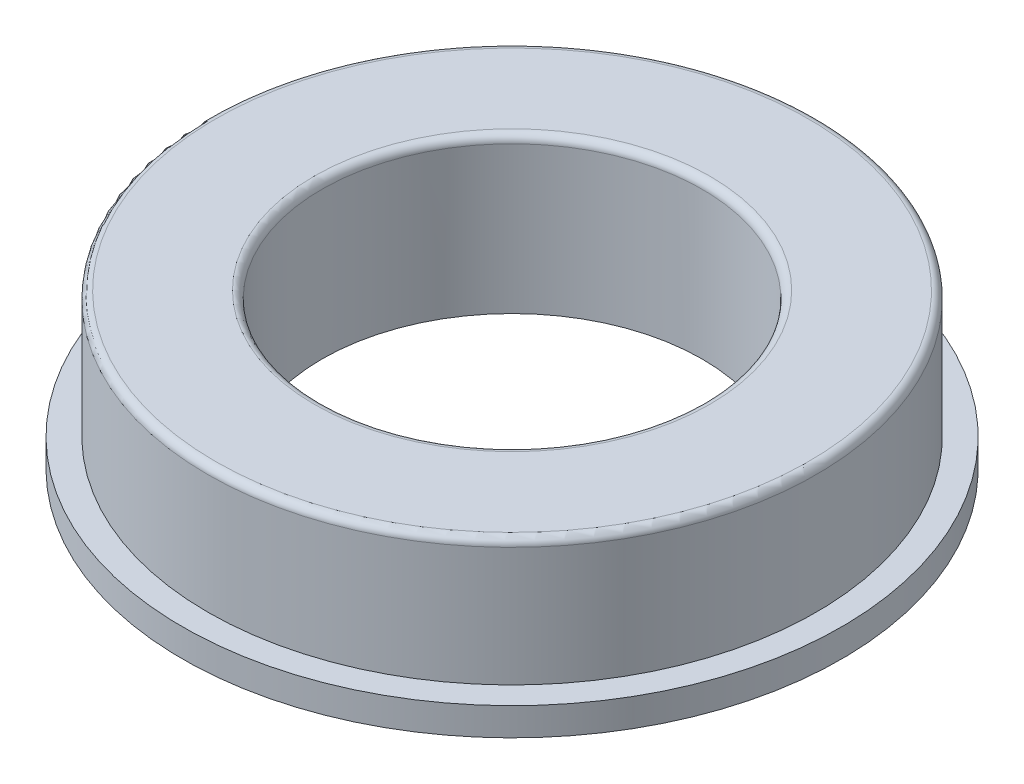
from build123d import *

# Parameters (mm, degrees)
SKETCH_2_R          = 13
EXTRUDE_1_DEPTH     = 1.1
CUT_EXTRUDE_1_REACH = 21.053
SKETCH_3_R          = 7.5


with BuildPart() as part:
    # 草图1 → 旋转1 (revolve)
    with BuildSketch(Plane(origin=(0, 0, 0), x_dir=(-1, 0, 0), z_dir=(0, 0, -1))):
        with BuildLine():
            Line((-11.7, 0), (-7.8, 0))
            Line((-7.8, 0), (-7.5, 0))
            Line((-7.5, 0), (-7.5, 0.3))
            Line((-7.5, 0.3), (-7.5, 4.7))
            ThreePointArc((-7.5, 4.7), (-7.587867966, 4.912132034), (-7.8, 5))
            Line((-7.8, 5), (-11.7, 5))
            ThreePointArc((-11.7, 5), (-11.912132034, 4.912132034), (-12, 4.7))
            Line((-12, 4.7), (-12, 0.3))
            Line((-12, 0.3), (-12, 0))
            Line((-12, 0), (-11.7, 0))
        make_face()
    revolve(axis=Axis((0, -0.001250002, 0), (0, 1, 0)))

    # 草图2 → 凸台-拉伸1 (add)
    with BuildSketch(Plane.XZ):
        Circle(SKETCH_2_R)
    extrude(amount=EXTRUDE_1_DEPTH)

    # 草图3 → 切除-拉伸1 (cut, up to next)
    with BuildSketch(Plane(origin=(0, 0, 0), x_dir=(1, 0, 0), z_dir=(0, 1, 0)), mode=Mode.PRIVATE) as cut_extrude_1_sk1:
        Circle(SKETCH_3_R)
    cut_extrude_1_tool1 = extrude(cut_extrude_1_sk1.sketch, amount=-CUT_EXTRUDE_1_REACH, mode=Mode.PRIVATE) & part.part
    add(cut_extrude_1_tool1.solids().sort_by_distance((0, 0, 0))[0], mode=Mode.SUBTRACT)


solid = part.part
